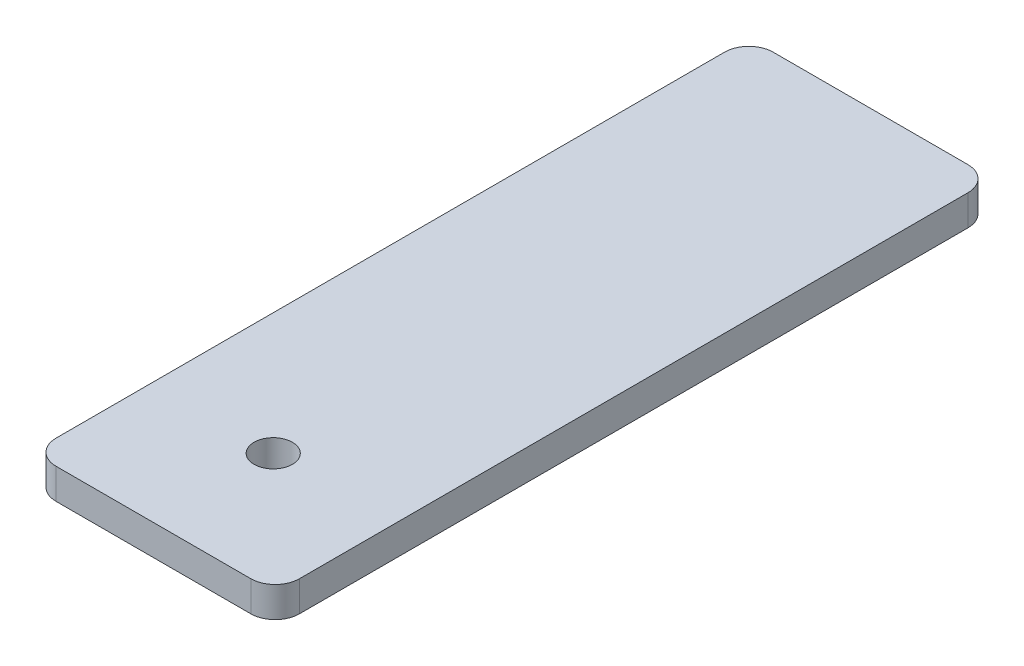
from build123d import *

# Parameters (mm, degrees)
SKETCH1_W           = 25.4
SKETCH1_H           = 74.825
BOSS_EXTRUDE1_DEPTH = 3.175
SKETCH2_R           = 2
CUT_EXTRUDE1_DEPTH  = 63.137257853
FILLET1_R           = 2.54


with BuildPart() as part:
    # Sketch1 → Boss-Extrude1 (new body)
    with BuildSketch(Plane(origin=(0, 0, 0), x_dir=(1, 0, 0), z_dir=(0, 1, 0))):
        with Locations((-13.581081081, 18.803716216)):
            Rectangle(SKETCH1_W, SKETCH1_H)
    extrude(amount=BOSS_EXTRUDE1_DEPTH)

    # Sketch2 → Cut-Extrude1 (cut, through all)
    with BuildSketch(Plane(origin=(0, 3.175, 0), x_dir=(1, 0, 0), z_dir=(0, 1, 0))):
        with Locations((-13.581081081, -6.108783784)):
            Circle(SKETCH2_R)
    extrude(amount=-CUT_EXTRUDE1_DEPTH, mode=Mode.SUBTRACT)

    # Fillet1
    fillet1_edges = [part.edges().sort_by_distance(p)[0] for p in [
        (-26.281081081, 1.5875, -56.216216216),
        (-0.881081081, 1.5875, -56.216216216),
        (-0.881081081, 1.5875, 18.608783784),
        (-26.281081081, 1.5875, 18.608783784),
    ]]
    fillet(fillet1_edges, radius=FILLET1_R)


solid = part.part
